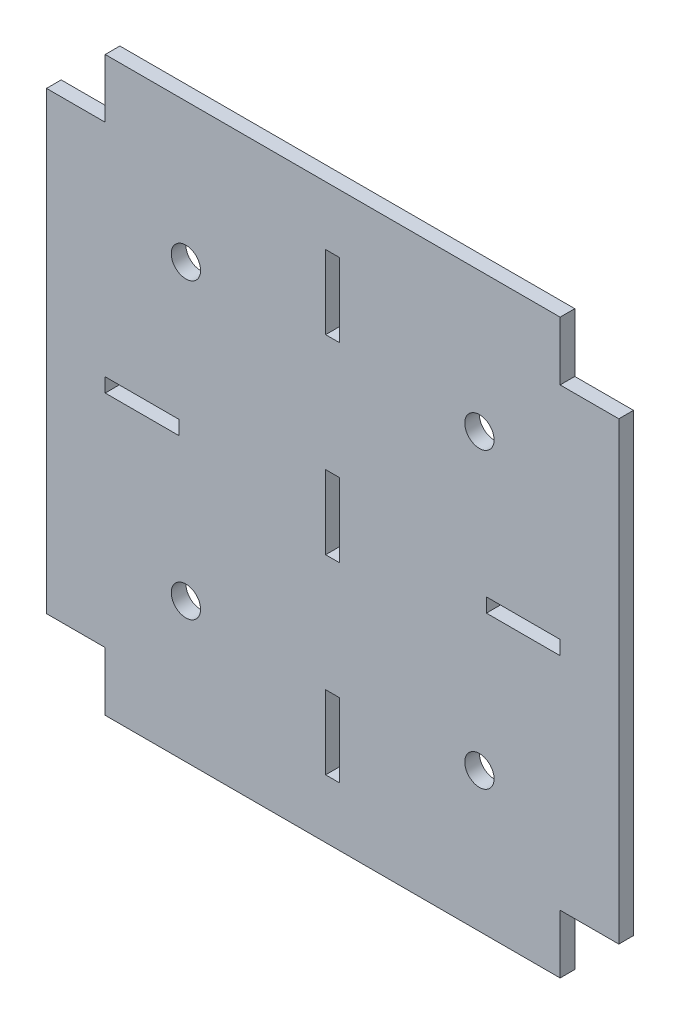
from build123d import *

# Parameters (mm, degrees)
SKETCH_1_R      = 2
SKETCH_1_W      = 1.92
SKETCH_1_H      = 10.05
SKETCH_1_W_2    = 10.05
SKETCH_1_H_2    = 1.92
EXTRUDE_1_DEPTH = 2


with BuildPart() as part:
    # 草圖1 → 填料-伸長1 (new body)
    with BuildSketch(Plane.XY):
        Polygon((-31, 39), (31, 39), (31, 31), (39, 31), (39, -31), (31, -31), (31, -39), (-31, -39), (-31, -31), (-39, -31), (-39, 31), (-31, 31), align=None)
        with Locations((-20, 20)):
            Circle(SKETCH_1_R, mode=Mode.SUBTRACT)
        with Locations((20, 20)):
            Circle(SKETCH_1_R, mode=Mode.SUBTRACT)
        with Locations((20, -20)):
            Circle(SKETCH_1_R, mode=Mode.SUBTRACT)
        with Locations((-20, -20)):
            Circle(SKETCH_1_R, mode=Mode.SUBTRACT)
        with Locations((0, -25.975)):
            Rectangle(SKETCH_1_W, SKETCH_1_H, mode=Mode.SUBTRACT)
        with Locations((0, 25.975)):
            Rectangle(SKETCH_1_W, SKETCH_1_H, mode=Mode.SUBTRACT)
        with Locations((-25.975, 0)):
            Rectangle(SKETCH_1_W_2, SKETCH_1_H_2, mode=Mode.SUBTRACT)
        with Locations((25.975, 0)):
            Rectangle(SKETCH_1_W_2, SKETCH_1_H_2, mode=Mode.SUBTRACT)
        Rectangle(SKETCH_1_W, SKETCH_1_H, mode=Mode.SUBTRACT)
    extrude(amount=EXTRUDE_1_DEPTH)


solid = part.part
